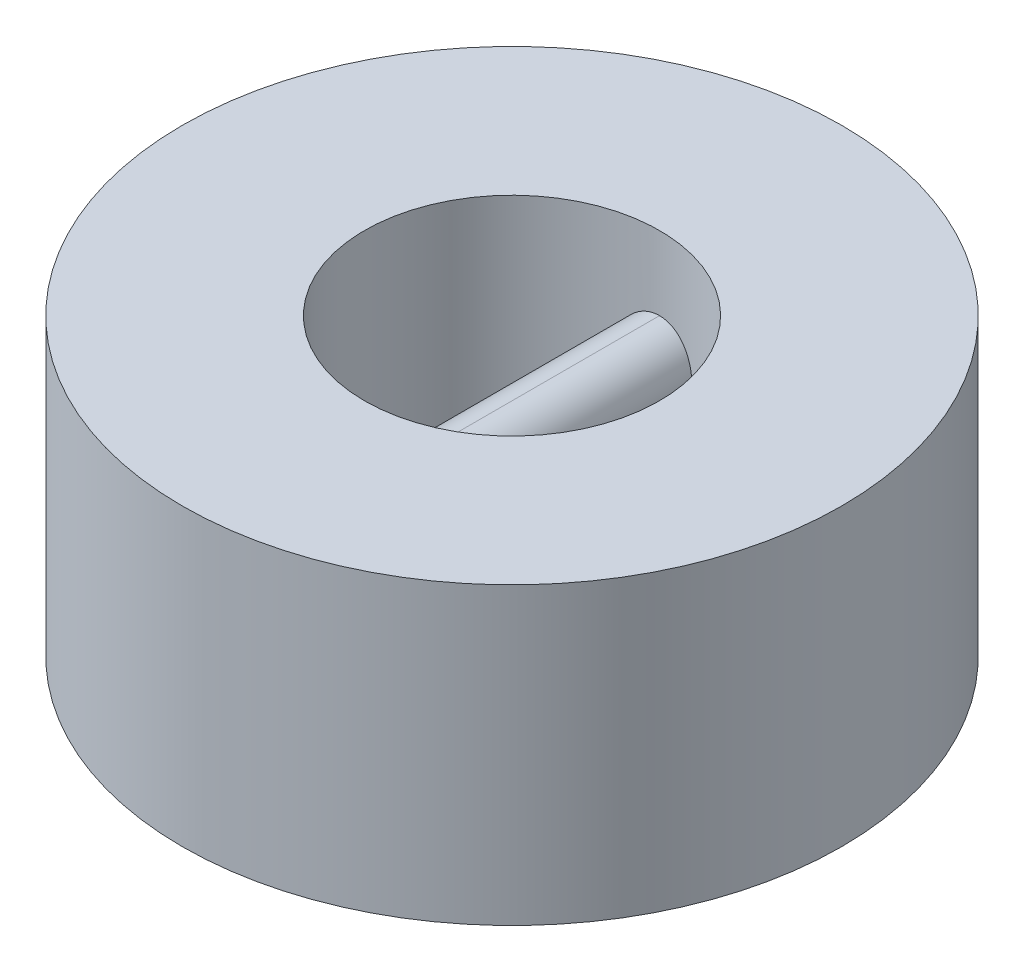
from build123d import *

# Parameters (mm, degrees)
SKETCH1_R               = 56.764595508
BOSS_EXTRUDE1_DEPTH     = 25.4
CUT_EXTRUDE1_DEPTH      = 85.199754194
CUT_EXTRUDE1_DEPTH_BACK = 85.199754194
SKETCH3_R               = 25.4
SKETCH4_W               = 12.7
SKETCH4_H               = 50.8
BOSS_EXTRUDE2_DEPTH     = 12.7
FILLET1_R               = 6.35


with BuildPart() as part:
    # Sketch1 → Boss-Extrude1 (new, symmetric)
    with BuildSketch(Plane(origin=(0, 0, 0), x_dir=(1, 0, 0), z_dir=(0, 1, 0))):
        with Locations(Location((0, 0, 0), (0, 0, 270))):
            Circle(SKETCH1_R)
    extrude(amount=BOSS_EXTRUDE1_DEPTH, both=True)

    # Sketch3 → Cut-Extrude1 (cut, two sides: drawn at the far end of the back side and taken through both)
    with BuildSketch(Plane(origin=(0, 0, 0), x_dir=(1, 0, 0), z_dir=(0, 1, 0)).offset(-CUT_EXTRUDE1_DEPTH_BACK)):
        with Locations(Location((0, 0, 0), (0, 0, 270))):
            Circle(SKETCH3_R)
    extrude(amount=CUT_EXTRUDE1_DEPTH + CUT_EXTRUDE1_DEPTH_BACK, mode=Mode.SUBTRACT)

    # Sketch4 → Boss-Extrude2 (add)
    with BuildSketch(Plane(origin=(0, 0, 0), x_dir=(1, 0, 0), z_dir=(0, 1, 0))):
        Rectangle(SKETCH4_W, SKETCH4_H)
    extrude(amount=BOSS_EXTRUDE2_DEPTH)

    # Fillet1
    # the kernel refuses this fillet: 6.35 mm, written as the material it takes off along each edge
    with BuildSketch(Plane(origin=(-6.35, 0, 40.468444248), x_dir=(0, 1, 0), z_dir=(0, 0, -1))) as fillet1_piece_1_section:
        with BuildLine():
            CenterArc((FILLET1_R, FILLET1_R), FILLET1_R, 180, 90)
            Line((0, FILLET1_R), (0, 0))
            Line((0, 0), (FILLET1_R, 0))
        make_face()
    fillet1_piece_1 = extrude(amount=80.936888497, mode=Mode.PRIVATE)
    fillet1_piece_1 = fillet1_piece_1 & Plane(origin=(0, 1.429605244, 0), x_dir=(0, 0, 1), z_dir=(0, 1, 0)) * Cylinder(25.4, 188, mode=Mode.PRIVATE)
    with BuildSketch(Plane(origin=(-6.35, 12.7, 40.468444248), x_dir=(1, 0, 0), z_dir=(0, 0, -1))) as fillet1_piece_2_section:
        with BuildLine():
            CenterArc((FILLET1_R, FILLET1_R), FILLET1_R, 180, 90)
            Line((0, FILLET1_R), (0, 0))
            Line((0, 0), (FILLET1_R, 0))
        make_face()
    fillet1_piece_2 = extrude(amount=80.936888497, mode=Mode.PRIVATE)
    fillet1_piece_2 = fillet1_piece_2 & Plane(origin=(0, 11.270396349, 0), x_dir=(0, 0, 1), z_dir=(0, 1, 0)) * Cylinder(25.4, 188, mode=Mode.PRIVATE)
    with BuildSketch(Plane(origin=(6.35, 0, -40.468444248), x_dir=(0, 1, 0), z_dir=(0, 0, 1))) as fillet1_piece_3_section:
        with BuildLine():
            CenterArc((FILLET1_R, FILLET1_R), FILLET1_R, 180, 90)
            Line((0, FILLET1_R), (0, 0))
            Line((0, 0), (FILLET1_R, 0))
        make_face()
    fillet1_piece_3 = extrude(amount=80.936888497, mode=Mode.PRIVATE)
    fillet1_piece_3 = fillet1_piece_3 & Plane(origin=(0, 1.429603632, 0), x_dir=(0, 0, 1), z_dir=(0, 1, 0)) * Cylinder(25.4, 188, mode=Mode.PRIVATE)
    with BuildSketch(Plane(origin=(6.35, 12.7, -40.468444248), x_dir=(0, -1, 0), z_dir=(0, 0, 1))) as fillet1_piece_4_section:
        with BuildLine():
            CenterArc((FILLET1_R, -FILLET1_R), FILLET1_R, 90, 90)
            Line((0, -FILLET1_R), (0, 0))
            Line((0, 0), (FILLET1_R, 0))
        make_face()
    fillet1_piece_4 = extrude(amount=80.936888497, mode=Mode.PRIVATE)
    fillet1_piece_4 = fillet1_piece_4 & Plane(origin=(0, 11.270396368, 0), x_dir=(0, 0, 1), z_dir=(0, 1, 0)) * Cylinder(25.4, 188, mode=Mode.PRIVATE)
    add([fillet1_piece_1, fillet1_piece_2, fillet1_piece_3, fillet1_piece_4], mode=Mode.SUBTRACT)


solid = part.part
